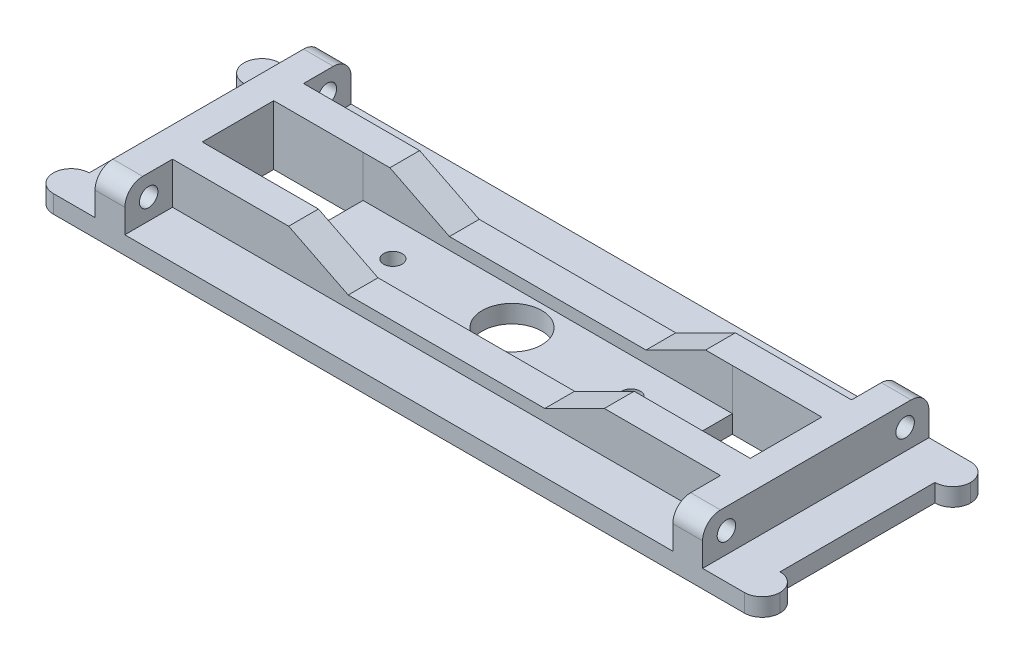
from build123d import *
from OCP.BRepFilletAPI import BRepFilletAPI_MakeChamfer

# Parameters (mm, degrees)
SKETCH_1_W               = 102
SKETCH_1_H               = 38
EXTRUDE_1_DEPTH          = 5
EXTRUDE_START            = -10
EXTRUDE_2_DEPTH          = 3
SKETCH_23_W              = 92
SKETCH_23_H              = 38
CUT_EXTRUDE_4_DEPTH      = 7
SKETCH_25_W              = 92.5
SKETCH_25_H              = 5
EXTRUDE_3_DEPTH          = 7
SKETCH_21_R              = 1.55
SKETCH_21_R_2            = 5
SKETCH_21_W              = 15
SKETCH_21_H              = 12
CUT_EXTRUDE_1_DEPTH      = 10
CUT_EXTRUDE_7_DEPTH      = 65.08587988
CUT_EXTRUDE_7_DEPTH_BACK = 65.08587988
SKETCH_27_W              = 53
SKETCH_27_H              = 12
CHAMFER_1_SIZE           = 5
CHAMFER_1_SIZE_2         = 10
CHAMFER_2_SIZE           = 5
CHAMFER_2_SIZE_2         = 10
SKETCH2_R                = 1.55
CUT_EXTRUDE1_DEPTH       = 114.710157858
FILLET1_R                = 3
FILLET2_R                = 3


with BuildPart() as part:
    # 草图1 → 凸台-拉伸1 (new, symmetric)
    with BuildSketch(Plane(origin=(0, 0, 0), x_dir=(1, 0, 0), z_dir=(0, 1, 0))):
        Rectangle(SKETCH_1_W, SKETCH_1_H)
    extrude(amount=EXTRUDE_1_DEPTH, both=True)

    # 草图4 → 凸台-拉伸2 (add)
    with BuildSketch(Plane(origin=(0, 5, 0), x_dir=(1, 0, 0), z_dir=(0, 1, 0)).offset(EXTRUDE_START)):
        Polygon((61, -19), (51, -19), (51, 19), (61, 19), (61, 13), (58, 13), (58, -13), (61, -13), align=None)
        Polygon((-61, 19), (-61, 13), (-58, 13), (-58, -13), (-61, -13), (-61, -19), (-51, -19), (-51, 19), align=None)
    extrude(amount=EXTRUDE_2_DEPTH)

    # 草图23 → 切除-拉伸4 (cut)
    with BuildSketch(Plane(origin=(0, 5, 0), x_dir=(1, 0, 0), z_dir=(0, 1, 0))):
        Rectangle(SKETCH_23_W, SKETCH_23_H)
    extrude(amount=-CUT_EXTRUDE_4_DEPTH, mode=Mode.SUBTRACT)

    # 草图25 → 凸台-拉伸3 (add)
    with BuildSketch(Plane(origin=(0, -2, 0), x_dir=(1, 0, 0), z_dir=(0, 1, 0))):
        with Locations((0.25, -8.496322734)):
            Rectangle(SKETCH_25_W, SKETCH_25_H)
        with Locations((0.25, 8.496322734)):
            Rectangle(SKETCH_25_W, SKETCH_25_H)
    extrude(amount=EXTRUDE_3_DEPTH)

    # 草图21 → 切除-拉伸1 (cut)
    with BuildSketch(Plane(origin=(0, -5, 0), x_dir=(-1, 0, 0), z_dir=(0, -1, 0))):
        with Locations(Location((-20, 0, 0), (0, 0, 270))):
            Circle(SKETCH_21_R)
        with Locations(Location((20, 0, 0), (0, 0, 90))):
            Circle(SKETCH_21_R)
        with Locations(Location((0, 0, 0), (0, 0, 90))):
            Circle(SKETCH_21_R_2)
        with Locations((-38.5, 0)):
            Rectangle(SKETCH_21_W, SKETCH_21_H)
        with Locations((38.5, 0)):
            Rectangle(SKETCH_21_W, SKETCH_21_H)
    extrude(amount=-CUT_EXTRUDE_1_DEPTH, mode=Mode.SUBTRACT)

    # 草图27 → 切除-拉伸7 (cut, two sides: drawn at the far end of the back side and taken through both)
    with BuildSketch(Plane.XY.offset(-CUT_EXTRUDE_7_DEPTH_BACK)):
        with Locations((0, 6)):
            Rectangle(SKETCH_27_W, SKETCH_27_H)
    extrude(amount=CUT_EXTRUDE_7_DEPTH + CUT_EXTRUDE_7_DEPTH_BACK, mode=Mode.SUBTRACT)

    # 倒角1
    chamfer_1_edges_1 = [part.edges().sort_by_distance(p)[0] for p in [
        (26.5, 0, -8.496322734),
    ]]
    chamfer_1_side_1 = [part.faces().sort_by_distance(p)[0] for p in [
        (26.5, 0.1, -8.496322734),
    ]]
    chamfer_1_edges_2 = [part.edges().sort_by_distance(p)[0] for p in [
        (26.5, 0, 8.496322734),
    ]]
    chamfer_1_side_2 = [part.faces().sort_by_distance(p)[0] for p in [
        (26.5, 0.1, 8.496322734),
    ]]
    chamfer_1 = BRepFilletAPI_MakeChamfer(part.part.solid().wrapped)
    for e in chamfer_1_edges_1:
        chamfer_1.Add(CHAMFER_1_SIZE - 0.0001, CHAMFER_1_SIZE_2 - 0.0001, e.wrapped, chamfer_1_side_1[0].wrapped)
    for e in chamfer_1_edges_2:
        chamfer_1.Add(CHAMFER_1_SIZE - 0.0001, CHAMFER_1_SIZE_2 - 0.0001, e.wrapped, chamfer_1_side_2[0].wrapped)
    add(Compound.cast(chamfer_1.Shape()), mode=Mode.REPLACE)  # a hair under: the kernel refuses the full size

    # 倒角2
    chamfer_2_edges_1 = [part.edges().sort_by_distance(p)[0] for p in [
        (-26.5, 0, -8.496322734),
    ]]
    chamfer_2_side_1 = [part.faces().sort_by_distance(p)[0] for p in [
        (-26.5, 0.1, -8.496322734),
    ]]
    chamfer_2_edges_2 = [part.edges().sort_by_distance(p)[0] for p in [
        (-26.5, 0, 8.496322734),
    ]]
    chamfer_2_side_2 = [part.faces().sort_by_distance(p)[0] for p in [
        (-26.4, 0, 8.496322734),
    ]]
    chamfer_2 = BRepFilletAPI_MakeChamfer(part.part.solid().wrapped)
    for e in chamfer_2_edges_1:
        chamfer_2.Add(CHAMFER_2_SIZE - 0.0001, CHAMFER_2_SIZE_2 - 0.0001, e.wrapped, chamfer_2_side_1[0].wrapped)
    for e in chamfer_2_edges_2:
        chamfer_2.Add(CHAMFER_2_SIZE_2 - 0.0001, CHAMFER_2_SIZE - 0.0001, e.wrapped, chamfer_2_side_2[0].wrapped)
    add(Compound.cast(chamfer_2.Shape()), mode=Mode.REPLACE)  # a hair under: the kernel refuses the full size

    # Sketch2 → Cut-Extrude1 (cut, through all)
    with BuildSketch(Plane(origin=(51, 0, 0), x_dir=(0, 0, -1), z_dir=(1, 0, 0))):
        with Locations((15, 1.5)):
            Circle(SKETCH2_R)
        with Locations((-15, 1.5)):
            Circle(SKETCH2_R)
    extrude(amount=-CUT_EXTRUDE1_DEPTH, mode=Mode.SUBTRACT)

    # Fillet1
    fillet1_edges = [part.edges().sort_by_distance(p)[0] for p in [
        (-61, -3.5, 19),
        (-61, -3.5, 13),
        (-61, -3.5, -13),
        (-61, -3.5, -19),
        (61, -3.5, -13),
        (61, -3.5, -19),
        (61, -3.5, 19),
        (61, -3.5, 13),
    ]]
    fillet(fillet1_edges, radius=FILLET1_R - 0.0001)  # a hair under: the kernel refuses the full size

    # Fillet2
    fillet2_edges = [part.edges().sort_by_distance(p)[0] for p in [
        (-48.5, 5, -19),
        (-48.5, 5, 19),
        (48.5, 5, 19),
        (48.5, 5, -19),
    ]]
    fillet(fillet2_edges, radius=FILLET2_R)


solid = part.part
